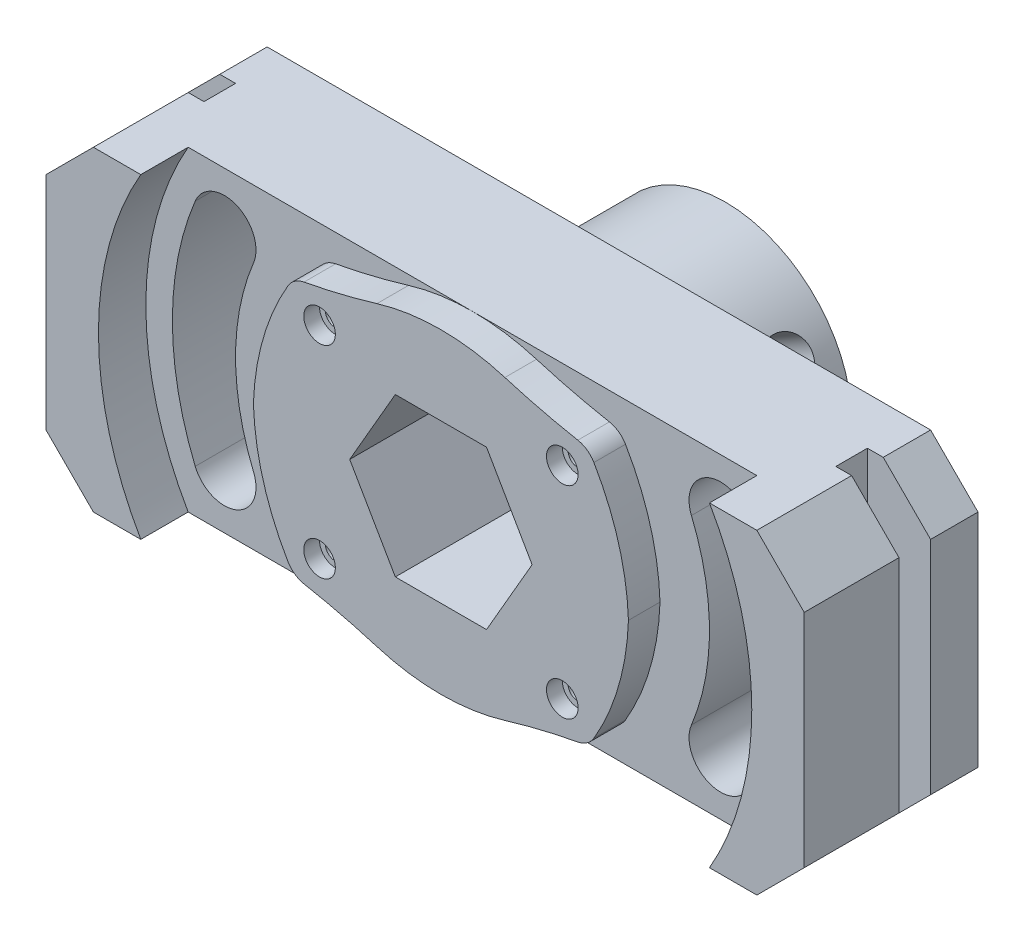
from build123d import *

# Parameters (mm, degrees)
SKETCH1_W                        = 152.4
SKETCH1_H                        = 63.5
BOSS_EXTRUDE1_DEPTH              = 25.4
BOSS_EXTRUDE2_DEPTH              = 9.525
BOSS_EXTRUDE3_DEPTH              = 6.35
CUT_EXTRUDE1_DEPTH               = 87.36933773
SKETCH5_R                        = 25.4
BOSS_EXTRUDE4_DEPTH              = 25.4
CUT_EXTRUDE2_DEPTH               = 103.242887894
F_7_16_20_TAPPED_HOLE2_OUTLINE_W = 4.96062
F_7_16_20_TAPPED_HOLE2_OUTLINE_H = 9.52526547
SKETCH13_R                       = 3.175
CUT_EXTRUDE3_DEPTH               = 3.175
F_10_32_TAPPED_HOLE1_D           = 4.0386
F_10_32_TAPPED_HOLE1_DEPTH       = 12.0396
F_10_32_TAPPED_HOLE1_TIP         = 1.213317848
FILLET1_R                        = 3.175
SKETCH16_W                       = 12.7
SKETCH16_H                       = 6.35
CUT_EXTRUDE4_DEPTH               = 106.159144277
CHAMFER1_SIZE                    = 9.525
CHAMFER2_SIZE                    = 9.525


# Read off the part's stored shape, not the designer's step: 7/16-20 Tapped Hole2
with BuildPart() as part:
    # Sketch1 → Boss-Extrude1 (new body)
    with BuildSketch(Plane.XY):
        Rectangle(SKETCH1_W, SKETCH1_H)
    extrude(amount=BOSS_EXTRUDE1_DEPTH)

    # Sketch2 → Boss-Extrude2 (add)
    with BuildSketch(Plane.XY.offset(25.4)):
        with BuildLine():
            Line((-57.15, 31.75), (-76.2, 31.75))
            Line((-76.2, 31.75), (-76.2, -31.75))
            Line((-76.2, -31.75), (-57.15, -31.75))
            ThreePointArc((-57.15, -31.75), (-65.65738686, 0), (-57.15, 31.75))
        make_face()
        with BuildLine():
            Line((57.15, 31.75), (76.2, 31.75))
            Line((76.2, 31.75), (76.2, -31.75))
            Line((76.2, -31.75), (57.15, -31.75))
            ThreePointArc((57.15, -31.75), (65.65738686, 0), (57.15, 31.75))
        make_face()
    extrude(amount=BOSS_EXTRUDE2_DEPTH)

    # Sketch3 → Boss-Extrude3 (add)
    with BuildSketch(Plane.XY.offset(25.4)):
        with BuildLine():
            ThreePointArc((0, 31.75), (-6.499067792, 31.272316494), (-12.858450657, 29.849532861))
            ThreePointArc((-12.858450657, 29.849532861), (-20.139715933, 27.86213325), (-27.51768912, 26.270878114))
            ThreePointArc((-27.51768912, 26.270878114), (-29.380205079, 25.48503317), (-30.748971212, 23.997418552))
            ThreePointArc((-30.748971212, 23.997418552), (-35.717260564, 12.431977761), (-37.689378393, 0))
            ThreePointArc((-37.689378393, 0), (-35.717260564, -12.431977761), (-30.748971212, -23.997418552))
            ThreePointArc((-30.748971212, -23.997418552), (-29.380205079, -25.48503317), (-27.51768912, -26.270878114))
            ThreePointArc((-27.51768912, -26.270878114), (-20.139715933, -27.86213325), (-12.858450657, -29.849532861))
            ThreePointArc((-12.858450657, -29.849532861), (-6.499067792, -31.272316494), (0, -31.75))
            ThreePointArc((0, -31.75), (6.499067792, -31.272316494), (12.858450657, -29.849532861))
            ThreePointArc((12.858450657, -29.849532861), (20.139715933, -27.86213325), (27.51768912, -26.270878114))
            ThreePointArc((27.51768912, -26.270878114), (29.380205079, -25.48503317), (30.748971212, -23.997418552))
            ThreePointArc((30.748971212, -23.997418552), (35.717260564, -12.431977761), (37.689378393, 0))
            ThreePointArc((37.689378393, 0), (35.717260564, 12.431977761), (30.748971212, 23.997418552))
            ThreePointArc((30.748971212, 23.997418552), (29.380205079, 25.48503317), (27.51768912, 26.270878114))
            ThreePointArc((27.51768912, 26.270878114), (20.139715933, 27.86213325), (12.858450657, 29.849532861))
            ThreePointArc((12.858450657, 29.849532861), (6.499067792, 31.272316494), (0, 31.75))
        make_face()
    extrude(amount=BOSS_EXTRUDE3_DEPTH)

    # Sketch4 → Cut-Extrude1 (cut, through all)
    with BuildSketch(Plane.XY.offset(25.4)):
        with BuildLine():
            ThreePointArc((-55.733032799, 23.085378057), (-60.325, 0), (-55.733032799, -23.085378057))
            ThreePointArc((-55.733032799, -23.085378057), (-47.436357972, -26.521973293), (-43.999762736, -18.225298466))
            ThreePointArc((-43.999762736, -18.225298466), (-47.625, 0), (-43.999762736, 18.225298466))
            ThreePointArc((-43.999762736, 18.225298466), (-47.436357972, 26.521973293), (-55.733032799, 23.085378057))
        make_face()
    cut_extrude1 = extrude(amount=-CUT_EXTRUDE1_DEPTH, mode=Mode.SUBTRACT)

    # Mirror1: Cut-Extrude1 across plane
    add(cut_extrude1.mirror(Plane(origin=(0, 0, 0), x_dir=(0, 0, 1), z_dir=(1, 0, 0))), mode=Mode.SUBTRACT)

    # Sketch5 → Boss-Extrude4 (add)
    with BuildSketch(Plane(origin=(0, 0, 0), x_dir=(-1, 0, 0), z_dir=(0, 0, -1))):
        with Locations(Location((0, 0, 0), (0, 0, 180))):
            Circle(SKETCH5_R)
    extrude(amount=BOSS_EXTRUDE4_DEPTH)

    # Sketch6 → Cut-Extrude2 (cut, through all)
    with BuildSketch(Plane(origin=(0, 0, -25.4), x_dir=(-1, 0, 0), z_dir=(0, 0, -1))):
        Polygon((9.165435523, -15.875), (18.330871047, 0), (9.165435523, 15.875), (-9.165435523, 15.875), (-18.330871047, 0), (-9.165435523, -15.875), align=None)
    extrude(amount=-CUT_EXTRUDE2_DEPTH, mode=Mode.SUBTRACT)

    # 7/16-20 Tapped Hole2 outline → 7/16-20 Tapped Hole2 (revolve, cut)
    with BuildSketch(Plane(origin=(0.052782238, -0.091421518, -15.875), x_dir=(0.5000000000000003, -0.8660254037844385, 0), z_dir=(0, 0, 1))):
        with Locations((2.48031, 20.637632735)):
            Rectangle(F_7_16_20_TAPPED_HOLE2_OUTLINE_W, F_7_16_20_TAPPED_HOLE2_OUTLINE_H)
    f_7_16_20_tapped_hole2 = revolve(axis=Axis((0.052782238, -0.091421518, -15.875), (0.8660254037844385, 0.5000000000000003, 0)), mode=Mode.SUBTRACT)

    # Mirror6: 7/16-20 Tapped Hole2 across plane
    add(f_7_16_20_tapped_hole2.mirror(Plane(origin=(0, 0, 0), x_dir=(0, 0, 1), z_dir=(1, 0, 0))), mode=Mode.SUBTRACT)

    # Sketch13 → Cut-Extrude3 (cut)
    with BuildSketch(Plane.XY.offset(31.75)):
        with Locations((-24.395903345, 20.32)):
            Circle(SKETCH13_R)
        with Locations((24.395903345, 20.32)):
            Circle(SKETCH13_R)
        with Locations((24.395903345, -20.32)):
            Circle(SKETCH13_R)
        with Locations((-24.395903345, -20.32)):
            Circle(SKETCH13_R)
    extrude(amount=-CUT_EXTRUDE3_DEPTH, mode=Mode.SUBTRACT)

    # #10-32 Tapped Hole1
    with Locations(Plane.XY.offset(28.575)):
        with Locations((-24.395903345, 20.32), (24.395903345, 20.32), (24.395903345, -20.32), (-24.395903345, -20.32)):
            Hole(F_10_32_TAPPED_HOLE1_D / 2, depth=F_10_32_TAPPED_HOLE1_DEPTH)
            with Locations((0, 0, -(F_10_32_TAPPED_HOLE1_DEPTH + F_10_32_TAPPED_HOLE1_TIP / 2))):  # 118° drill point
                Cone(0, F_10_32_TAPPED_HOLE1_D / 2, F_10_32_TAPPED_HOLE1_TIP, mode=Mode.SUBTRACT)

    # Fillet1
    fillet1_edges = [part.edges().sort_by_distance(p)[0] for p in [
        (-25.4, 0, 0),
    ]]
    fillet(fillet1_edges, radius=FILLET1_R)

    # Sketch16 → Cut-Extrude4 (cut, through all)
    with BuildSketch(Plane(origin=(0, 31.75, 0), x_dir=(1, 0, 0), z_dir=(0, 1, 0))):
        with Locations((69.85, -12.7)):
            Rectangle(SKETCH16_W, SKETCH16_H)
        with Locations((-69.85, -12.7)):
            Rectangle(SKETCH16_W, SKETCH16_H)
    extrude(amount=-CUT_EXTRUDE4_DEPTH, mode=Mode.SUBTRACT)

    # Chamfer1
    chamfer1_edges = [part.edges().sort_by_distance(p)[0] for p in [
        (-76.2, 31.75, 4.7625),
        (76.2, 31.75, 4.7625),
        (-76.2, 31.75, 25.4),
        (76.2, 31.75, 25.4),
    ]]
    chamfer(chamfer1_edges, length=CHAMFER1_SIZE)

    # Chamfer2
    chamfer2_edges = [part.edges().sort_by_distance(p)[0] for p in [
        (76.2, -31.75, 4.7625),
        (-76.2, -31.75, 4.7625),
        (76.2, -31.75, 25.4),
        (-76.2, -31.75, 25.4),
    ]]
    chamfer(chamfer2_edges, length=CHAMFER2_SIZE)


solid = part.part
